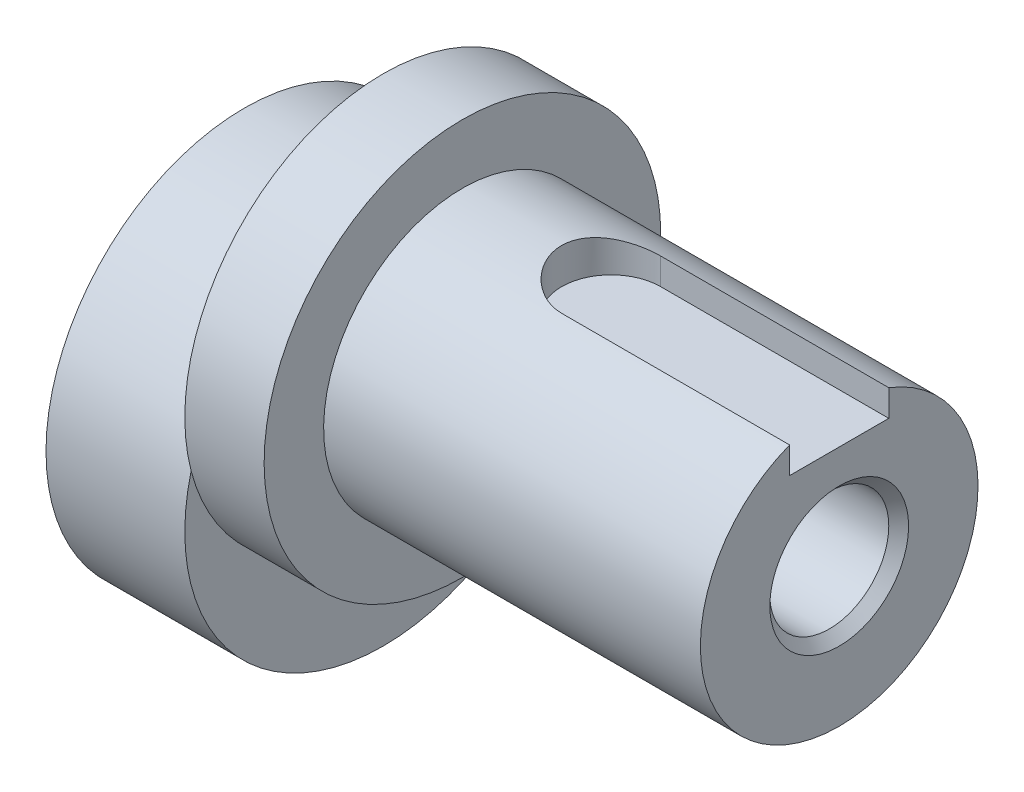
from build123d import *

# Parameters (mm, degrees)
SKETCH1_R           = 10
BOSS_EXTRUDE1_DEPTH = 7
SKETCH2_R           = 10
BOSS_EXTRUDE2_DEPTH = 4
SKETCH3_R           = 7
BOSS_EXTRUDE3_DEPTH = 19
SKETCH4_R           = 3
CUT_EXTRUDE1_DEPTH  = 36
CHAMFER1_SIZE       = 0.5
CUT_EXTRUDE2_START  = 10.2
CUT_EXTRUDE2_DEPTH  = 25.8


with BuildPart() as part:
    # Sketch1 → Boss-Extrude1 (new body)
    with BuildSketch(Plane(origin=(0, 0, 0), x_dir=(0, 0, -1), z_dir=(1, 0, 0))):
        Circle(SKETCH1_R)
    extrude(amount=BOSS_EXTRUDE1_DEPTH)

    # Sketch2 → Boss-Extrude2 (add)
    with BuildSketch(Plane(origin=(7, 0, 0), x_dir=(0, 0, -1), z_dir=(1, 0, 0))):
        with Locations((0, 5)):
            Circle(SKETCH2_R)
    extrude(amount=BOSS_EXTRUDE2_DEPTH)

    # Sketch3 → Boss-Extrude3 (add)
    with BuildSketch(Plane(origin=(11, 0, 0), x_dir=(0, 0, -1), z_dir=(1, 0, 0))):
        with Locations((0, 5)):
            Circle(SKETCH3_R)
    extrude(amount=BOSS_EXTRUDE3_DEPTH)

    # Sketch4 → Cut-Extrude1 (cut, through all)
    with BuildSketch(Plane(origin=(30, 0, 0), x_dir=(0, 0, -1), z_dir=(1, 0, 0))):
        with Locations((0, 5)):
            Circle(SKETCH4_R)
    extrude(amount=-CUT_EXTRUDE1_DEPTH, mode=Mode.SUBTRACT)

    # Chamfer1
    chamfer1_edges = [part.edges().sort_by_distance(p)[0] for p in [
        (30, 5, 3),
        (0, 5, 3),
    ]]
    chamfer(chamfer1_edges, length=CHAMFER1_SIZE)

    # Sketch5 → Cut-Extrude2 (cut, through all)
    with BuildSketch(Plane(origin=(0, 0, 0), x_dir=(1, 0, 0), z_dir=(0, 1, 0)).offset(CUT_EXTRUDE2_START)):
        with BuildLine():
            Line((31, 2.5), (18.5, 2.5))
            ThreePointArc((18.5, 2.5), (16, 0), (18.5, -2.5))
            Line((18.5, -2.5), (31, -2.5))
            Line((31, -2.5), (31, 2.5))
        make_face()
    extrude(amount=CUT_EXTRUDE2_DEPTH, mode=Mode.SUBTRACT)


solid = part.part
